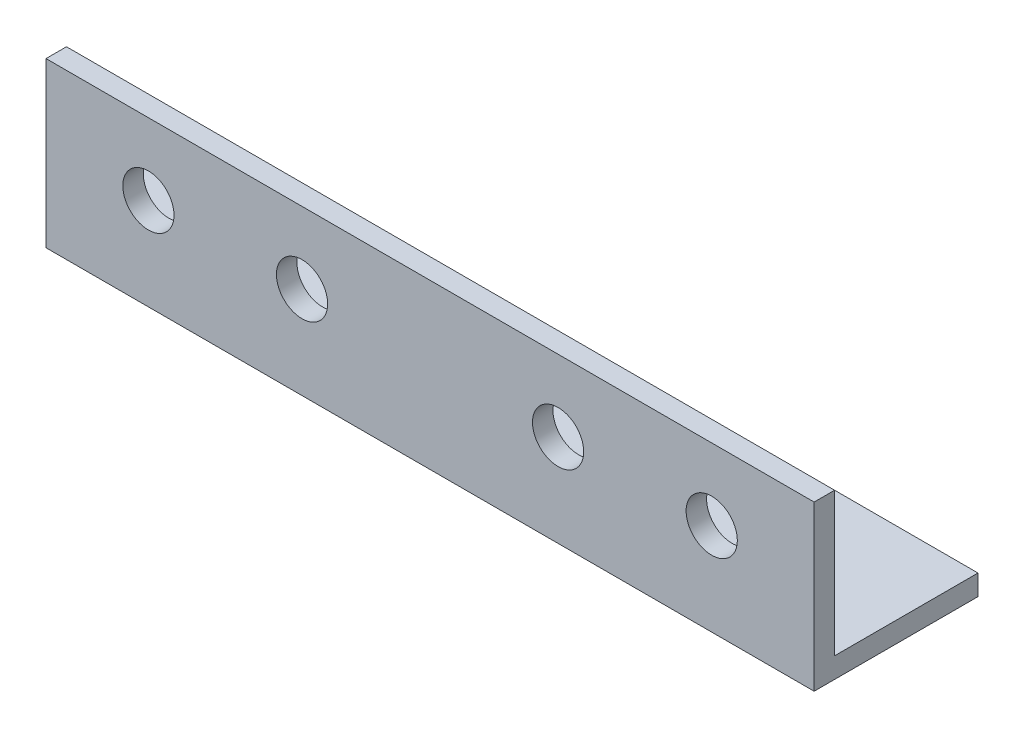
from build123d import *

# Parameters (mm, degrees)
EXTRUDE_1_DEPTH     = 150
SKETCH_2_R          = 5
CUT_EXTRUDE_1_DEPTH = 156.910230582


with BuildPart() as part:
    # Эскиз1 → Вытянуть-Тонкостенный1 (new body)
    with BuildSketch(Plane(origin=(0, 0, 0), x_dir=(0, 0, -1), z_dir=(1, 0, 0))):
        Polygon((0, 32), (0, 0), (32, 0), (32, 4), (4, 4), (4, 32), align=None)
    extrude(amount=EXTRUDE_1_DEPTH)

    # Эскиз2 → Вырез-Вытянуть1 (cut, through all)
    with BuildSketch(Plane(origin=(0, 0, -4), x_dir=(-1, 0, 0), z_dir=(0, 0, -1))):
        with Locations((-130, 18)):
            Circle(SKETCH_2_R)
        with Locations((-100, 18)):
            Circle(SKETCH_2_R)
        with Locations((-50, 18)):
            Circle(SKETCH_2_R)
        with Locations((-20, 18)):
            Circle(SKETCH_2_R)
    extrude(amount=-CUT_EXTRUDE_1_DEPTH, mode=Mode.SUBTRACT)


solid = part.part
